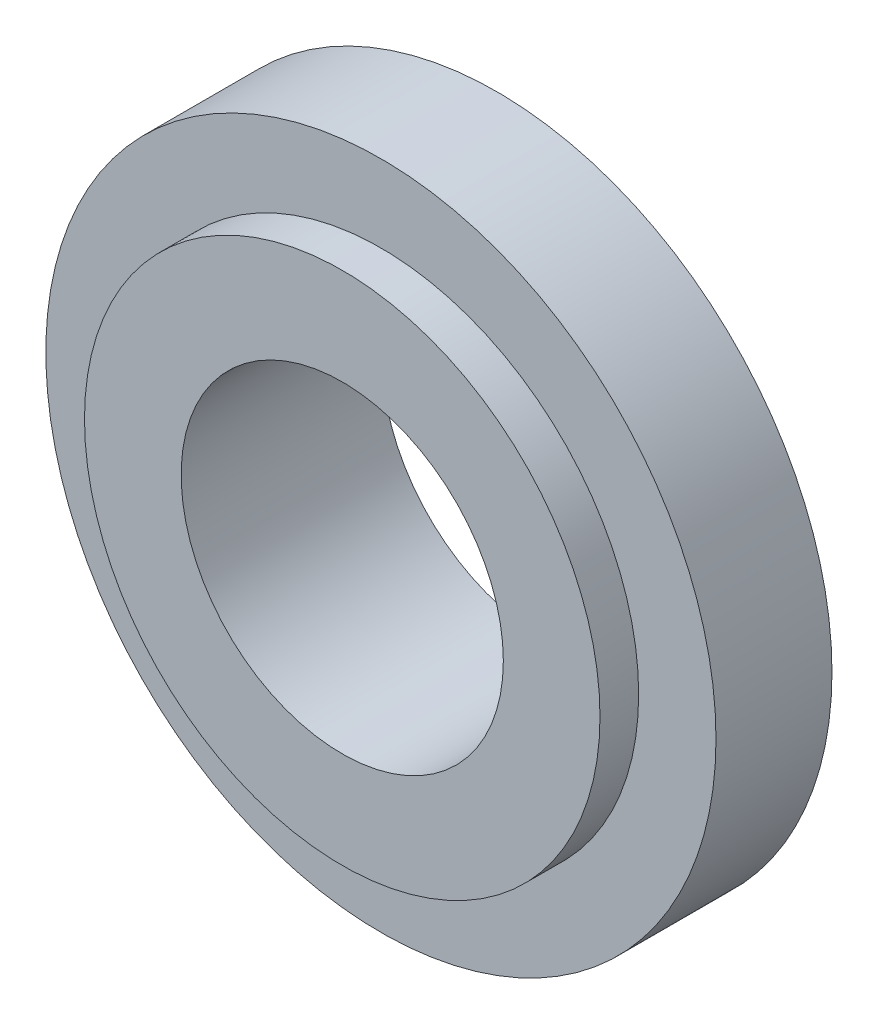
from build123d import *

# Parameters (mm, degrees)
SKETCH1_R           = 12.7
SKETCH1_R_2         = 7.9375
BOSS_EXTRUDE1_DEPTH = 9.906
SKETCH2_R           = 16.51
SKETCH2_R_2         = 7.9375
BOSS_EXTRUDE2_DEPTH = 2.8575


with BuildPart() as part:
    # Sketch1 → Boss-Extrude1 (new body)
    with BuildSketch(Plane.XY):
        Circle(SKETCH1_R)
        Circle(SKETCH1_R_2, mode=Mode.SUBTRACT)
    extrude(amount=BOSS_EXTRUDE1_DEPTH)

    # Sketch2 → Boss-Extrude2 (add, symmetric)
    with BuildSketch(Plane.XY.offset(5.1435)):
        Circle(SKETCH2_R)
        Circle(SKETCH2_R_2, mode=Mode.SUBTRACT)
    extrude(amount=BOSS_EXTRUDE2_DEPTH, both=True)


solid = part.part
